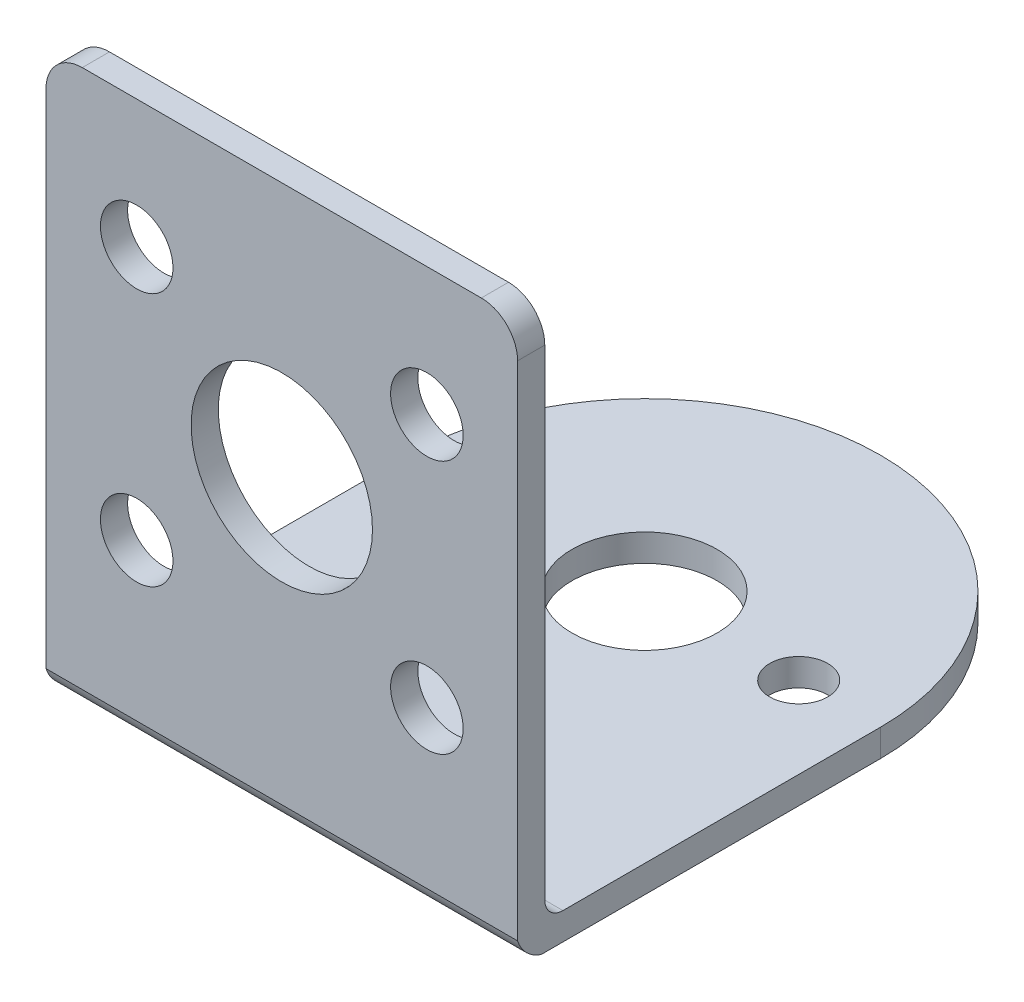
from build123d import *

# Parameters (mm, degrees)
SKETCH1_R           = 40
SKETCH1_R_2         = 16
BOSS_EXTRUDE1_DEPTH = 15
SKETCH2_R           = 50
SKETCH2_R_2         = 20
BOSS_EXTRUDE2_DEPTH = 15
CUT_EXTRUDE2_START  = -260
CUT_EXTRUDE2_DEPTH  = 260
FILLET1_R           = 10
SCALE2_SCALE        = 0.1


# Read off the part's stored shape, not the designer's step: Cut-Extrude2
with BuildPart() as part:
    # Sketch1 → Boss-Extrude1 (new body)
    with BuildSketch(Plane(origin=(0, 0, 0), x_dir=(1, 0, 0), z_dir=(0, 1, 0))):
        with BuildLine():
            Line((-130, -200), (-130, 0))
            ThreePointArc((-130, 0), (0, 130), (130, 0))
            Line((130, 0), (130, -200))
            Line((130, -200), (-130, -200))
        make_face()
        with Locations(Location((0, 0, 0), (0, 0, 270))):
            Circle(SKETCH1_R, mode=Mode.SUBTRACT)
        with Locations(Location((-85, 0, 0), (0, 0, 270))):
            Circle(SKETCH1_R_2, mode=Mode.SUBTRACT)
        with Locations(Location((85, 0, 0), (0, 0, 270))):
            Circle(SKETCH1_R_2, mode=Mode.SUBTRACT)
    extrude(amount=BOSS_EXTRUDE1_DEPTH)

    # Sketch2 → Boss-Extrude2 (add)
    with BuildSketch(Plane.XY.offset(200)):
        with BuildLine():
            Line((-130, 0), (-130, 290))
            ThreePointArc((-130, 290), (-124.142135624, 304.142135624), (-110, 310))
            Line((-110, 310), (110, 310))
            ThreePointArc((110, 310), (124.142135624, 304.142135624), (130, 290))
            Line((130, 290), (130, 0))
            Line((130, 0), (-130, 0))
        make_face()
        with Locations((0, 169.361818375)):
            Circle(SKETCH2_R, mode=Mode.SUBTRACT)
        with Locations((80, 239.361818375)):
            Circle(SKETCH2_R_2, mode=Mode.SUBTRACT)
        with Locations((-80, 239.361818375)):
            Circle(SKETCH2_R_2, mode=Mode.SUBTRACT)
        with Locations((-80, 99.361818375)):
            Circle(SKETCH2_R_2, mode=Mode.SUBTRACT)
        with Locations((80, 99.361818375)):
            Circle(SKETCH2_R_2, mode=Mode.SUBTRACT)
    extrude(amount=-BOSS_EXTRUDE2_DEPTH)

    # Cut-Extrude2 outline → Cut-Extrude2 (cut)
    with BuildSketch(Plane.ZY.offset(130).offset(CUT_EXTRUDE2_START)):
        with BuildLine():
            ThreePointArc((200, 13.029030935), (195.075286181, 4.924713819), (186.970969065, 0))
            Line((186.970969065, 0), (200, 0))
            Line((200, 0), (200, 13.029030935))
        make_face()
    extrude(amount=CUT_EXTRUDE2_DEPTH, mode=Mode.SUBTRACT)

    # Fillet1
    fillet1_edges = [part.edges().sort_by_distance(p)[0] for p in [
        (0, 15, 185),
    ]]
    fillet(fillet1_edges, radius=FILLET1_R)


with BuildPart() as part_1:
    # Scale2: scaled about (0, 79.825718393, 117.542480981)
    add(part.part.scale(SCALE2_SCALE).moved(Location((0, 71.843146554, 105.788232883))))


solid = part_1.part
